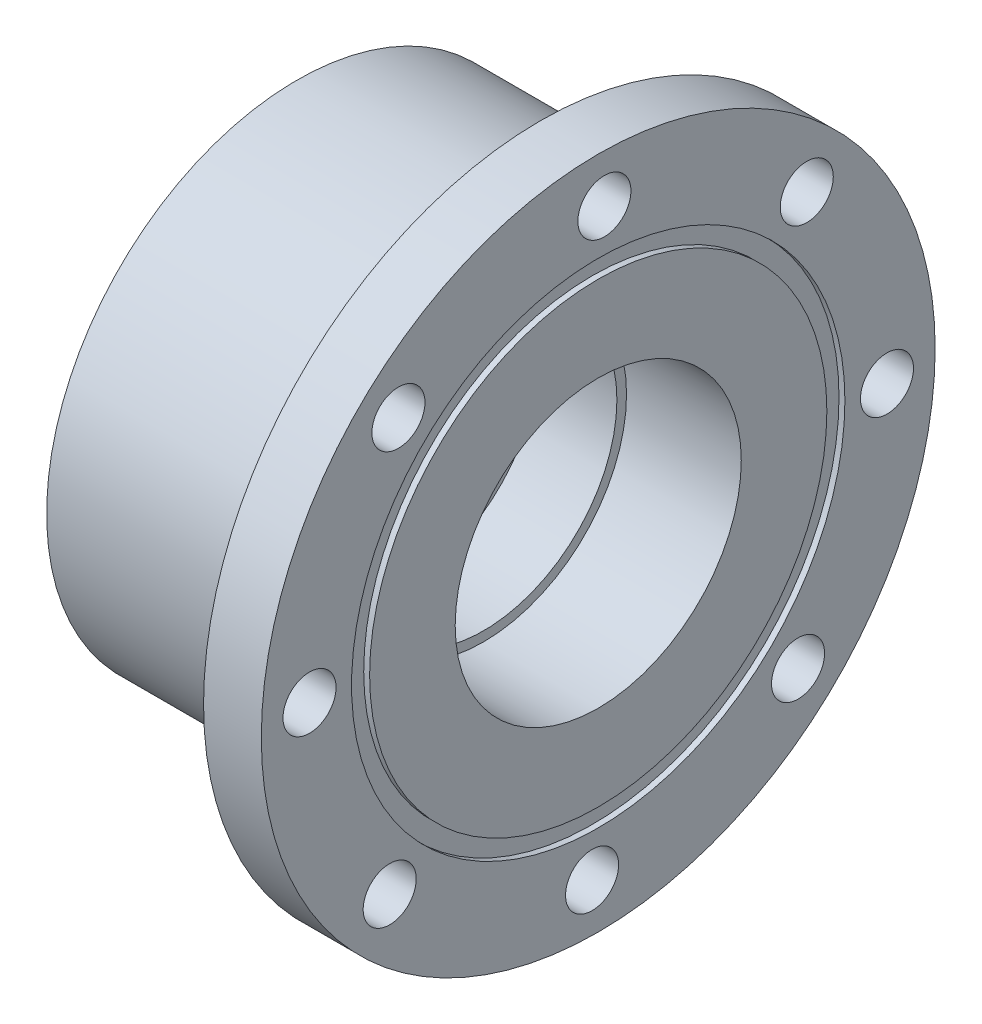
from build123d import *

# Parameters (mm, degrees)
M6_CLEARANCE_HOLE1_D = 7


with BuildPart() as part:
    # Main sketch → Revolve1 (revolve)
    with BuildSketch(Plane.XY):
        Polygon((0, 9.000000034), (0, 19.995000015), (-8.000000002, 19.995000015), (-8.000000002, 33.02), (24.13, 33.02), (24.13, 44.45), (31.75, 44.45), (31.75, 32.54375), (30.972125, 32.54375), (30.972125, 30.1625), (31.75, 30.1625), (31.75, 18.8722), (16.6116, 18.8722), (16.6116, 17.6022), (6.35, 17.6022), (6.35, 9.000000034), align=None)
    revolve(axis=Axis((71.950113838, 0, 0), (-1, 0, 0)))

    # M6 Clearance Hole1 (through all)
    with Locations(Plane(origin=(31.75, 0, 0), x_dir=(0, 0, -1), z_dir=(1, 0, 0))):
        with Locations((0, 0), (-38.091322418, 0.813115257), (-27.509591698, -26.359673074), (-0.813115257, -38.091322418), (26.359673074, -27.509591698), (38.091322418, -0.813115257), (27.509591698, 26.359673074), (0.813115257, 38.091322418), (-26.359673074, 27.509591698)):
            Hole(M6_CLEARANCE_HOLE1_D / 2)


solid = part.part
